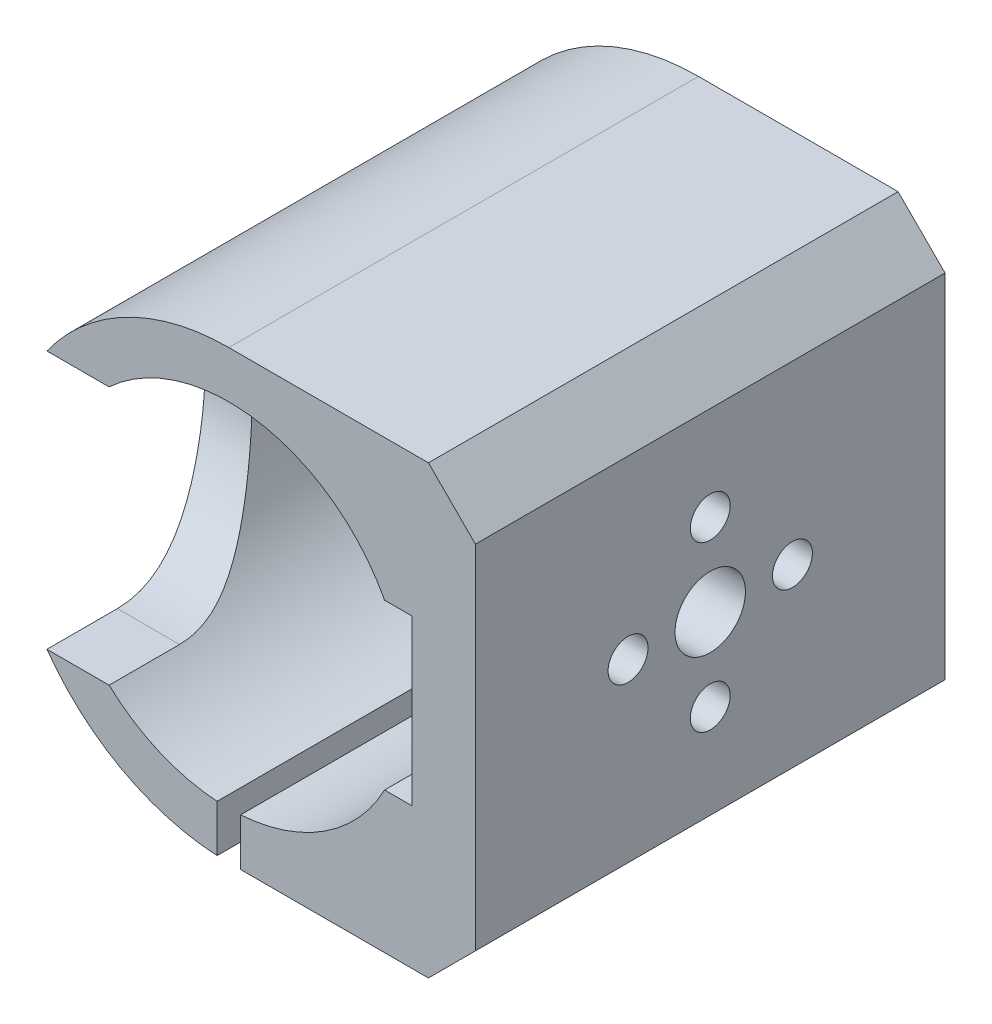
from build123d import *

# Parameters (mm, degrees)
BOSS_EXTRUDE1_DEPTH      = 40
EXTRUDE_START            = -25
SKETCH_5_W               = 10
SKETCH_5_H               = 28
EXTRUDE_2_DEPTH          = 15
CUT_EXTRUDE1_DEPTH       = 53.39274759
CUT_EXTRUDE1_DEPTH_BACK  = 53.39274759
SKETCH2_R                = 15
SKETCH5_R                = 11
CUT_EXTRUDE3_DEPTH       = 10
SKETCH7_W                = 6.152946469
SKETCH7_H                = 22
CUT_EXTRUDE9_DEPTH       = 10
SKETCH_2_W               = 5
SKETCH_2_H               = 14
CUT_EXTRUDE_2_DEPTH      = 20
CUT_EXTRUDE_6_DEPTH      = 51.368641203
CUT_EXTRUDE_6_DEPTH_BACK = 51.368641203
SKETCH_7_R               = 1.85
SKETCH6_W                = 2
SKETCH6_H                = 28
CUT_EXTRUDE8_DEPTH       = 53.392747702
CUT_EXTRUDE10_REACH      = 63.871
SKETCH8_R                = 3
CUT_EXTRUDE11_REACH      = 61.843
SKETCH13_R               = 3.25
SKETCH14_W               = 40
SKETCH14_H               = 38
SKETCH14_R               = 3
SKETCH14_R_2             = 1.7
BOSS_EXTRUDE2_DEPTH      = 2
CIRPATTERN1_START        = 10
CIRPATTERN1_OUTLINE_R    = 3.25
CIRPATTERN1_DEPTH        = 8.6
CIRPATTERN1_START_2      = 18.6
CIRPATTERN1_2_OUTLINE_R  = 1.7
CIRPATTERN1_2_DEPTH      = 2.4
CIRPATTERN2_START        = 15.6
CIRPATTERN2_OUTLINE_R    = 3.25
CIRPATTERN2_DEPTH        = 3
CIRPATTERN2_START_2      = 18.6
CIRPATTERN2_2_OUTLINE_R  = 1.7
CIRPATTERN2_2_DEPTH      = 2.4
CHAMFER1_SIZE            = 4


with BuildPart() as part:
    # Sketch1 → Boss-Extrude1 (new body)
    with BuildSketch(Plane.XY):
        with BuildLine():
            Line((0, 19), (19, 19))
            Line((19, 19), (19, -19))
            Line((19, -19), (0, -19))
            ThreePointArc((0, -19), (-19, 0), (0, 19))
        make_face()
    extrude(amount=BOSS_EXTRUDE1_DEPTH)

    # 草圖5 → 填料-伸長2 (add)
    with BuildSketch(Plane.XY.offset(40).offset(EXTRUDE_START)):
        with Locations((0, -14)):
            Rectangle(SKETCH_5_W, SKETCH_5_H)
    extrude(amount=-EXTRUDE_2_DEPTH)

    # Sketch2 → Cut-Extrude1 (cut, two sides: drawn at the far end of the back side and taken through both)
    with BuildSketch(Plane.XY.offset(40).offset(-CUT_EXTRUDE1_DEPTH_BACK)):
        Circle(SKETCH2_R)
    extrude(amount=CUT_EXTRUDE1_DEPTH + CUT_EXTRUDE1_DEPTH_BACK, mode=Mode.SUBTRACT)

    # Sketch5 → Cut-Extrude3 (cut)
    with BuildSketch(Plane(origin=(-19, 0, 0), x_dir=(0, 1, 0), z_dir=(-1, 0, 0))):
        with Locations((0, -34)):
            Circle(SKETCH5_R)
    extrude(amount=-CUT_EXTRUDE3_DEPTH, mode=Mode.SUBTRACT)

    # Sketch7 → Cut-Extrude9 (cut)
    with BuildSketch(Plane.ZY.offset(19)):
        with Locations((37.076473234, 0)):
            Rectangle(SKETCH7_W, SKETCH7_H)
    extrude(amount=-CUT_EXTRUDE9_DEPTH, mode=Mode.SUBTRACT)

    # 草圖2 → 除料-伸長2 (cut)
    with BuildSketch(Plane.XY.offset(40)):
        with Locations((13.1, 0)):
            Rectangle(SKETCH_2_W, SKETCH_2_H)
    extrude(amount=-CUT_EXTRUDE_2_DEPTH, mode=Mode.SUBTRACT)

    # 草圖7 → 除料-伸長6 (cut, two sides: drawn at the far end of the back side and taken through both)
    with BuildSketch(Plane(origin=(0, -5, 0), x_dir=(0, 0, 1), z_dir=(-1, 0, 0)).offset(-CUT_EXTRUDE_6_DEPTH_BACK)):
        with Locations(Location((7.5, -18, 0), (0, 0, 90))):
            Circle(SKETCH_7_R)
    extrude(amount=CUT_EXTRUDE_6_DEPTH + CUT_EXTRUDE_6_DEPTH_BACK, mode=Mode.SUBTRACT)

    # Sketch6 → Cut-Extrude8 (cut, through all)
    with BuildSketch(Plane.XY):
        with Locations((0, -14)):
            Rectangle(SKETCH6_W, SKETCH6_H)
    extrude(amount=CUT_EXTRUDE8_DEPTH, mode=Mode.SUBTRACT)

    # Sketch8 → Cut-Extrude10 (cut, up to next)
    with BuildSketch(Plane(origin=(19, 0, 0), x_dir=(0, 0, -1), z_dir=(1, 0, 0)), mode=Mode.PRIVATE) as cut_extrude10_sk1:
        with Locations((-20, 0)):
            Circle(SKETCH8_R)
    cut_extrude10_tool1 = extrude(cut_extrude10_sk1.sketch, amount=-CUT_EXTRUDE10_REACH, mode=Mode.PRIVATE) & part.part
    add(cut_extrude10_tool1.solids().sort_by_distance((19, 0, 20))[0], mode=Mode.SUBTRACT)

    # Sketch12 → CBORE for M3 SHCS1 (revolve, cut)
    with BuildSketch(Plane(origin=(15.6, 7, 20), x_dir=(0, 0, 1), z_dir=(0, 1, 0))):
        Polygon((0, 0), (0, 3.4), (1.7, 3.4), (1.7, 3), (3.25, 3), (3.25, 0), align=None)
    revolve(axis=Axis((9.25, 7, 20), (1, 0, 0)), mode=Mode.SUBTRACT)

    # Sketch13 → Cut-Extrude11 (cut, up to next)
    with BuildSketch(Plane(origin=(15.6, 0, 0), x_dir=(0, 0, -1), z_dir=(1, 0, 0)), mode=Mode.PRIVATE) as cut_extrude11_sk1:
        with Locations(Location((-20, 7, 0), (0, 0, 180))):
            Circle(SKETCH13_R)
    cut_extrude11_tool1 = extrude(cut_extrude11_sk1.sketch, amount=-CUT_EXTRUDE11_REACH, mode=Mode.PRIVATE) & part.part
    add(cut_extrude11_tool1.solids().sort_by_distance((15.6, 7, 20))[0], mode=Mode.SUBTRACT)

    # Sketch14 → Boss-Extrude2 (add)
    with BuildSketch(Plane(origin=(19, 0, 0), x_dir=(0, 0, -1), z_dir=(1, 0, 0))):
        with Locations((-20, 0)):
            Rectangle(SKETCH14_W, SKETCH14_H)
        with Locations((-20, 0)):
            Circle(SKETCH14_R, mode=Mode.SUBTRACT)
        with Locations(Location((-20, 7, 0), (0, 0, 180))):
            Circle(SKETCH14_R_2, mode=Mode.SUBTRACT)
    extrude(amount=BOSS_EXTRUDE2_DEPTH)

    # CirPattern1: read off the stored shape, not the designer's step
    # CirPattern1 outline → CirPattern1 (cut)
    with BuildSketch(Plane.YZ.offset(CIRPATTERN1_START)):
        with Locations((0, 13)):
            Circle(CIRPATTERN1_OUTLINE_R)
        with Locations((-7, 20)):
            Circle(CIRPATTERN1_OUTLINE_R)
    extrude(amount=CIRPATTERN1_DEPTH, mode=Mode.SUBTRACT)

    # CirPattern1 2 outline → CirPattern1 2 (cut)
    with BuildSketch(Plane.YZ.offset(CIRPATTERN1_START_2)):
        with Locations((0, 13)):
            Circle(CIRPATTERN1_2_OUTLINE_R)
        with Locations((-7, 20)):
            Circle(CIRPATTERN1_2_OUTLINE_R)
    extrude(amount=CIRPATTERN1_2_DEPTH, mode=Mode.SUBTRACT)

    # CirPattern2: read off the stored shape, not the designer's step
    # CirPattern2 outline → CirPattern2 (cut)
    with BuildSketch(Plane.YZ.offset(CIRPATTERN2_START)):
        with Locations((0, 27)):
            Circle(CIRPATTERN2_OUTLINE_R)
    extrude(amount=CIRPATTERN2_DEPTH, mode=Mode.SUBTRACT)

    # CirPattern2 2 outline → CirPattern2 2 (cut)
    with BuildSketch(Plane.YZ.offset(CIRPATTERN2_START_2)):
        with Locations((0, 27)):
            Circle(CIRPATTERN2_2_OUTLINE_R)
    extrude(amount=CIRPATTERN2_2_DEPTH, mode=Mode.SUBTRACT)

    # Chamfer1
    chamfer1_edges = [part.edges().sort_by_distance(p)[0] for p in [
        (21, -19, 20),
        (21, 19, 20),
        (-3, -28, 15),
        (-3, -28, 0),
        (3, -28, 15),
        (3, -28, 0),
    ]]
    chamfer(chamfer1_edges, length=CHAMFER1_SIZE)


solid = part.part
